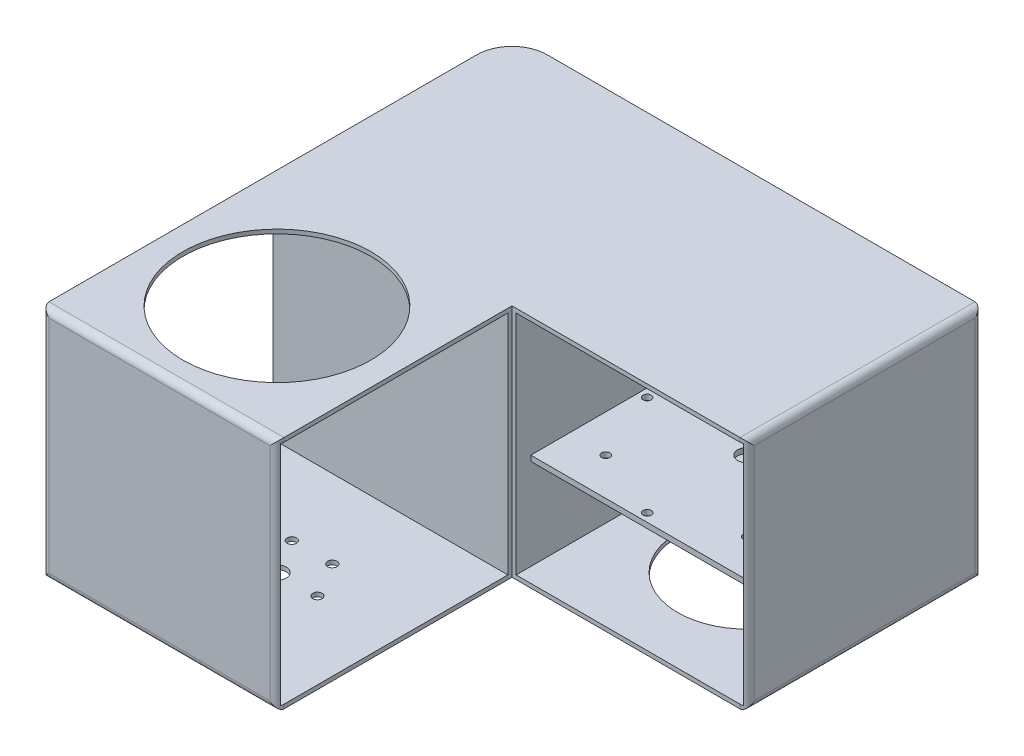
from build123d import *

# Parameters (mm, degrees)
EXTRUDE_1_DEPTH      = 100
SKETCH_2_R           = 40
CUT_EXTRUDE_1_DEPTH  = 90
SKETCH_9_W           = 96.5
SKETCH_9_H           = 96.5
CUT_EXTRUDE_3_DEPTH  = 100
SKETCH_15_R          = 4
EXTRUDE_4_DEPTH      = 5
SKETCH_16_R          = 29.5
CUT_EXTRUDE_5_DEPTH  = 5
SKETCH_19_W          = 96.5
SKETCH_19_H          = 96.5
CUT_EXTRUDE_8_DEPTH  = 99
SKETCH_20_R          = 2
SKETCH_20_R_2        = 4
CUT_EXTRUDE_9_DEPTH  = 1.75
SKETCH_23_W          = 92
SKETCH_23_H          = 92
EXTRUDE_5_DEPTH      = 57.3
SKETCH_24_R          = 1.75
SKETCH_24_R_2        = 4
CUT_EXTRUDE_10_DEPTH = 3
CUT_EXTRUDE_START    = -5
SKETCH_27_W          = 92
SKETCH_27_H          = 92
CUT_EXTRUDE_12_DEPTH = 50
FILLET_2_R           = 3
FILLET_6_R           = 15


with BuildPart() as part:
    # 草图1 → 凸台-拉伸1 (new body)
    with BuildSketch(Plane(origin=(0, 0, 0), x_dir=(1, 0, 0), z_dir=(0, 1, 0))):
        Polygon((-50, 50), (-50, 150), (50, 150), (150, 150), (150, 50), (50, 50), (50, -50), (-50, -50), align=None)
    extrude(amount=EXTRUDE_1_DEPTH)

    # 草图2 → 切除-拉伸1 (cut)
    with BuildSketch(Plane(origin=(0, 100, 0), x_dir=(1, 0, 0), z_dir=(0, 1, 0))):
        with Locations(Location((0, 0, 0), (0, 0, 270))):
            Circle(SKETCH_2_R)
    extrude(amount=-CUT_EXTRUDE_1_DEPTH, mode=Mode.SUBTRACT)

    # 草图9 → 切除-拉伸3 (cut)
    with BuildSketch(Plane.ZY.offset(50)):
        with Locations((0, 50)):
            Rectangle(SKETCH_9_W, SKETCH_9_H)
    extrude(amount=-CUT_EXTRUDE_3_DEPTH, mode=Mode.SUBTRACT)

    # 草图15 → 凸台-拉伸4 (add)
    with BuildSketch(Plane(origin=(0, 0, -150), x_dir=(-1, 0, 0), z_dir=(0, 0, -1))):
        with Locations(Location((-89.023351099, 21, 0), (0, 0, 180))):
            Circle(SKETCH_15_R)
        with Locations(Location((-89.023351099, 79, 0), (0, 0, 180))):
            Circle(SKETCH_15_R)
    extrude(amount=EXTRUDE_4_DEPTH)

    # 草图16 → 切除-拉伸5 (cut)
    with BuildSketch(Plane.XZ):
        with Locations((100, -100)):
            Circle(SKETCH_16_R)
    extrude(amount=-CUT_EXTRUDE_5_DEPTH, mode=Mode.SUBTRACT)

    # 草图19 → 切除-拉伸8 (cut)
    with BuildSketch(Plane.XY.offset(-50)):
        with Locations((100, 50)):
            Rectangle(SKETCH_19_W, SKETCH_19_H)
    extrude(amount=-CUT_EXTRUDE_8_DEPTH, mode=Mode.SUBTRACT)

    # 草图20 → 切除-拉伸9 (cut)
    with BuildSketch(Plane(origin=(0, 1.75, 0), x_dir=(1, 0, 0), z_dir=(0, 1, 0))):
        with Locations(Location((17.25, 0, 0), (0, 0, 270))):
            Circle(SKETCH_20_R)
        with Locations(Location((8.625, -14.938938215, 0), (0, 0, 270))):
            Circle(SKETCH_20_R)
        with Locations(Location((-8.625, -14.938938215, 0), (0, 0, 270))):
            Circle(SKETCH_20_R)
        with Locations(Location((-17.25, 0, 0), (0, 0, 270))):
            Circle(SKETCH_20_R)
        with Locations(Location((-8.625, 14.938938215, 0), (0, 0, 270))):
            Circle(SKETCH_20_R)
        with Locations(Location((8.625, 14.938938215, 0), (0, 0, 270))):
            Circle(SKETCH_20_R)
        with Locations(Location((0, 0, 0), (0, 0, 270))):
            Circle(SKETCH_20_R_2)
    extrude(amount=-CUT_EXTRUDE_9_DEPTH, mode=Mode.SUBTRACT)

    # 草图23 → 凸台-拉伸5 (add)
    with BuildSketch(Plane(origin=(0, 100, 0), x_dir=(1, 0, 0), z_dir=(0, 1, 0))):
        with Locations((100, 100)):
            Rectangle(SKETCH_23_W, SKETCH_23_H)
    extrude(amount=-EXTRUDE_5_DEPTH)

    # 草图24 → 切除-拉伸10 (cut)
    with BuildSketch(Plane.XZ.offset(-42.7)):
        with Locations(Location((100, -57.5, 0), (0, 0, 270))):
            Circle(SKETCH_24_R)
        with Locations(Location((130.0520382, -69.9479618, 0), (0, 0, 270))):
            Circle(SKETCH_24_R)
        with Locations(Location((142.5, -100, 0), (0, 0, 270))):
            Circle(SKETCH_24_R)
        with Locations(Location((130.0520382, -130.0520382, 0), (0, 0, 270))):
            Circle(SKETCH_24_R)
        with Locations(Location((100, -142.5, 0), (0, 0, 270))):
            Circle(SKETCH_24_R)
        with Locations(Location((69.9479618, -130.0520382, 0), (0, 0, 270))):
            Circle(SKETCH_24_R)
        with Locations(Location((57.5, -100, 0), (0, 0, 270))):
            Circle(SKETCH_24_R)
        with Locations(Location((69.9479618, -69.9479618, 0), (0, 0, 270))):
            Circle(SKETCH_24_R)
        with Locations(Location((100, -100, 0), (0, 0, 270))):
            Circle(SKETCH_24_R_2)
    extrude(amount=-CUT_EXTRUDE_10_DEPTH, mode=Mode.SUBTRACT)

    # 草图27 → 切除-拉伸12 (cut)
    with BuildSketch(Plane(origin=(0, 100, 0), x_dir=(1, 0, 0), z_dir=(0, 1, 0)).offset(CUT_EXTRUDE_START)):
        with Locations((98.652941691, 99.180600888)):
            Rectangle(SKETCH_27_W, SKETCH_27_H)
    extrude(amount=-CUT_EXTRUDE_12_DEPTH, mode=Mode.SUBTRACT)

    # 圆角2
    # the kernel refuses this fillet: 3 mm, written as the material it takes off along each edge
    with BuildSketch(Plane(origin=(50, -7.5, 50), x_dir=(-1, 0, 0), z_dir=(0, 1, 0)), Plane(origin=(57.5, 0, 50), x_dir=(0, 0, -1), z_dir=(-1, 0, 0)), Plane(origin=(-50, -7.5, 50), x_dir=(0, 0, -1), z_dir=(0, 1, 0)), Plane(origin=(150, 0, -157.5), x_dir=(-1, 0, 0), z_dir=(0, 0, 1))) as fillet_2_piece_1:
        with BuildLine():
            CenterArc((FILLET_2_R, -FILLET_2_R), FILLET_2_R, 90, 90)
            Line((0, -FILLET_2_R), (0, 0))
            Line((0, 0), (FILLET_2_R, 0))
        make_face()
    extrude(amount=115, mode=Mode.SUBTRACT)
    with BuildSketch(Plane(origin=(57.5, 100, 50), x_dir=(0, 0, -1), z_dir=(-1, 0, 0)), Plane(origin=(150, 100, -157.5), x_dir=(-1, 0, 0), z_dir=(0, 0, 1)), Plane(origin=(150, -7.5, -50), x_dir=(0, 0, -1), z_dir=(0, 1, 0)), Plane(origin=(150, -7.5, -150), x_dir=(-1, 0, 0), z_dir=(0, 1, 0))) as fillet_2_piece_2:
        with BuildLine():
            CenterArc((FILLET_2_R, FILLET_2_R), FILLET_2_R, 180, 90)
            Line((0, FILLET_2_R), (0, 0))
            Line((0, 0), (FILLET_2_R, 0))
        make_face()
    extrude(amount=115, mode=Mode.SUBTRACT)

    # 圆角6
    fillet_6_edges = [part.edges().sort_by_distance(p)[0] for p in [
        (-50, 50, -150),
    ]]
    fillet(fillet_6_edges, radius=FILLET_6_R)


solid = part.part
